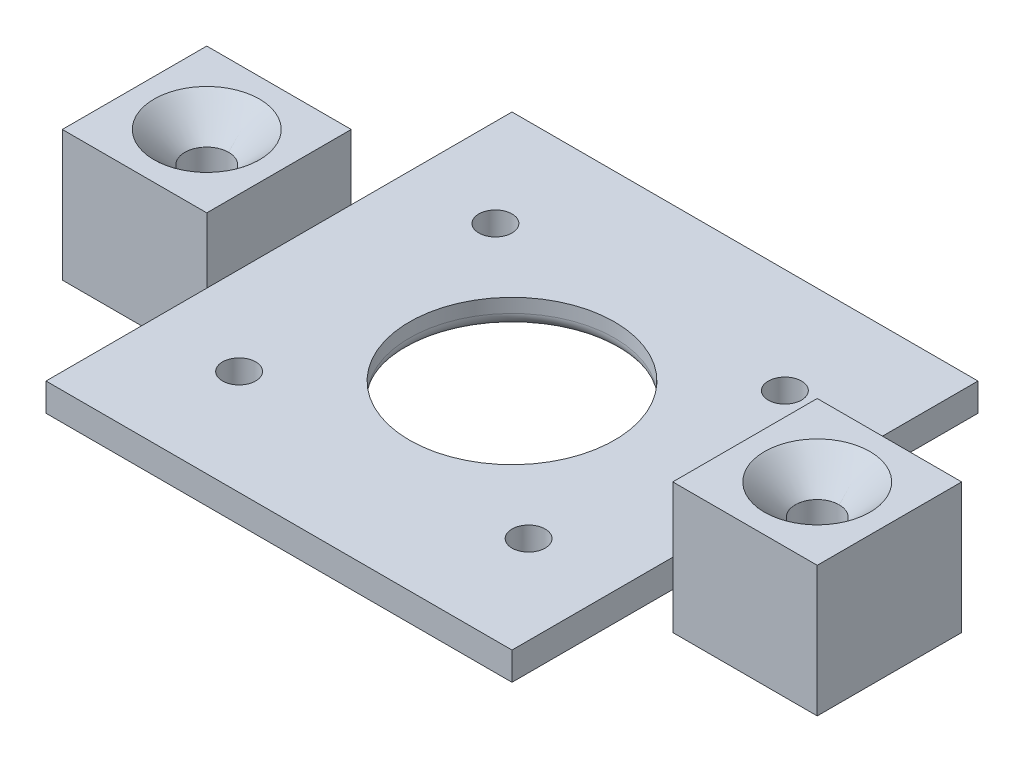
from build123d import *

# Parameters (mm, degrees)
SKETCH1_W               = 50
SKETCH1_H               = 50
BOSS_EXTRUDE1_DEPTH     = 3
CUT_EXTRUDE1_DEPTH      = 71.774289117
CUT_EXTRUDE1_DEPTH_BACK = 71.774289117
SKETCH2_R               = 11
CUT_EXTRUDE2_DEPTH      = 71.774289117
CUT_EXTRUDE2_DEPTH_BACK = 71.774289117
SKETCH3_R               = 1.78
FILLET1_R               = 1.5
SKETCH4_W               = 15.5
SKETCH4_H               = 15.5
SKETCH4_R               = 2.35
BOSS_EXTRUDE3_DEPTH     = 10
BOSS_EXTRUDE4_START     = 4
SKETCH6_W               = 15.5
SKETCH6_H               = 15.5
SKETCH6_R               = 2.35
BOSS_EXTRUDE4_DEPTH     = 4
FILLET3_SIZE            = 3.3


with BuildPart() as part:
    # Sketch1 → Boss-Extrude1 (new body)
    with BuildSketch(Plane(origin=(0, 0, 0), x_dir=(1, 0, 0), z_dir=(0, 1, 0))):
        with Locations((25, -25)):
            Rectangle(SKETCH1_W, SKETCH1_H)
    extrude(amount=BOSS_EXTRUDE1_DEPTH)

    # Sketch2 → Cut-Extrude1 (cut, two sides: drawn at the far end of the back side and taken through both)
    with BuildSketch(Plane(origin=(0, 3, 0), x_dir=(1, 0, 0), z_dir=(0, 1, 0)).offset(-CUT_EXTRUDE1_DEPTH_BACK)):
        with Locations(Location((25, -25, 0), (0, 0, 270))):
            Circle(SKETCH2_R)
    extrude(amount=CUT_EXTRUDE1_DEPTH + CUT_EXTRUDE1_DEPTH_BACK, mode=Mode.SUBTRACT)

    # Sketch3 → Cut-Extrude2 (cut, two sides: drawn at the far end of the back side and taken through both)
    with BuildSketch(Plane(origin=(0, 3, 0), x_dir=(1, 0, 0), z_dir=(0, 1, 0)).offset(-CUT_EXTRUDE2_DEPTH_BACK)):
        with Locations(Location((9.47, -11.25, 0), (0, 0, 270))):
            Circle(SKETCH3_R)
        with Locations(Location((40.53, -11.25, 0), (0, 0, 270))):
            Circle(SKETCH3_R)
        with Locations(Location((40.53, -38.75, 0), (0, 0, 270))):
            Circle(SKETCH3_R)
        with Locations(Location((9.47, -38.75, 0), (0, 0, 270))):
            Circle(SKETCH3_R)
    extrude(amount=CUT_EXTRUDE2_DEPTH + CUT_EXTRUDE2_DEPTH_BACK, mode=Mode.SUBTRACT)

    # Fillet1
    fillet1_edges = [part.edges().sort_by_distance(p)[0] for p in [
        (25, 0, 14),
    ]]
    fillet(fillet1_edges, radius=FILLET1_R)

    # Sketch4 → Boss-Extrude3 (add)
    # profile 1 of 2: a face of its own
    with BuildSketch(Plane.XZ):
        with Locations((-7.75, 25)):
            Rectangle(SKETCH4_W, SKETCH4_H)
        with Locations(Location((-7.75, 25, 0), (0, 0, 270))):
            Circle(SKETCH4_R, mode=Mode.SUBTRACT)
    # profile 2 of 2: a face of its own
    with BuildSketch(Plane.XZ):
        with Locations((57.75, 25)):
            Rectangle(SKETCH4_W, SKETCH4_H)
        with Locations(Location((57.75, 25, 0), (0, 0, 270))):
            Circle(SKETCH4_R, mode=Mode.SUBTRACT)
    extrude(amount=-BOSS_EXTRUDE3_DEPTH)

    # Sketch6 → Boss-Extrude4 (add)
    # profile 1 of 2: a face of its own
    with BuildSketch(Plane.XZ.offset(BOSS_EXTRUDE4_START)):
        with Locations((-7.75, 25)):
            Rectangle(SKETCH6_W, SKETCH6_H)
        with Locations(Location((-7.75, 25, 0), (0, 0, 270))):
            Circle(SKETCH6_R, mode=Mode.SUBTRACT)
    # profile 2 of 2: a face of its own
    with BuildSketch(Plane.XZ.offset(BOSS_EXTRUDE4_START)):
        with Locations((57.75, 25)):
            Rectangle(SKETCH6_W, SKETCH6_H)
        with Locations(Location((57.75, 25, 0), (0, 0, 270))):
            Circle(SKETCH6_R, mode=Mode.SUBTRACT)
    extrude(amount=-BOSS_EXTRUDE4_DEPTH)

    # Fillet3
    # a fillet whose section is not a circle: 3.3 mm, written as the material it takes off along each edge
    with BuildSketch(Plane(origin=(-7.75, 10, 25), x_dir=(0, 0, -1), z_dir=(-1, 0, 0))) as fillet3_piece_1:
        with BuildLine():
            Bezier((2.35, FILLET3_SIZE), (2.35, 0), (2.35 + FILLET3_SIZE, 0), weights=[1, 0.016667517, 1])
            Line((2.35 + FILLET3_SIZE, 0), (2.35, 0))
            Line((2.35, 0), (2.35, FILLET3_SIZE))
        make_face()
    revolve(axis=Axis((-7.75, 10, 25), (0, -1, 0)), mode=Mode.SUBTRACT)
    with BuildSketch(Plane(origin=(57.75, 10, 25), x_dir=(0, 0, -1), z_dir=(-1, 0, 0))) as fillet3_piece_2:
        with BuildLine():
            Bezier((2.35, FILLET3_SIZE), (2.35, 0), (2.35 + FILLET3_SIZE, 0), weights=[1, 0.016667517, 1])
            Line((2.35 + FILLET3_SIZE, 0), (2.35, 0))
            Line((2.35, 0), (2.35, FILLET3_SIZE))
        make_face()
    revolve(axis=Axis((57.75, 10, 25), (0, -1, 0)), mode=Mode.SUBTRACT)


solid = part.part
